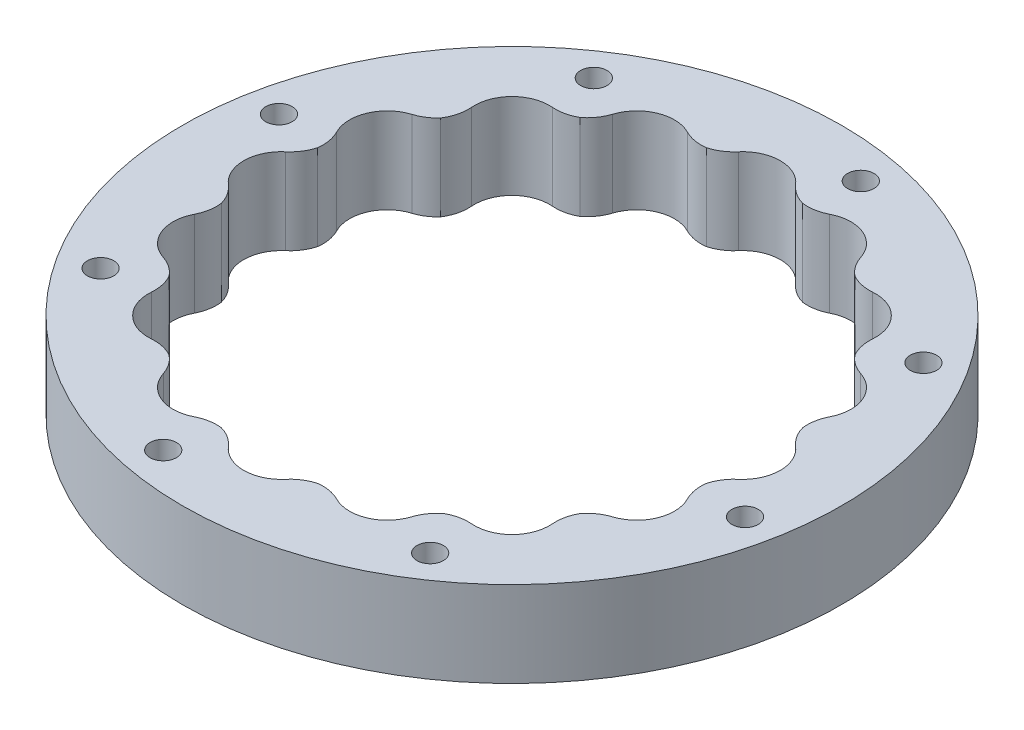
from build123d import *

# Parameters (mm, degrees)
SKETCH1_R           = 50
BOSS_EXTRUDE1_DEPTH = 13
FILLET1_R           = 6
FILLET2_R           = 6
SKETCH2_R           = 2
CUT_EXTRUDE1_DEPTH  = 13
CIRPATTERN1_COUNT   = 8


with BuildPart() as part:
    # Sketch1 → Boss-Extrude1 (new body)
    with BuildSketch(Plane(origin=(0, 0, 0), x_dir=(1, 0, 0), z_dir=(0, 1, 0))):
        with Locations(Location((0, 0, 0), (0, 0, 90))):
            Circle(SKETCH1_R)
        with BuildLine():
            ThreePointArc((36.323181231, 9.32075669), (36.779448015, 7.315887076), (37.125142857, 5.289023335))
            ThreePointArc((37.125142857, 5.289023335), (39.722463038, 3.191918366), (40.7, 0))
            ThreePointArc((40.7, 0), (39.722463038, -3.191918366), (37.125142857, -5.289023335))
            ThreePointArc((37.125142857, -5.289023335), (36.779448015, -7.315887076), (36.323181231, -9.32075669))
            ThreePointArc((36.323181231, -9.32075669), (37.590218254, -11.184640418), (38.035783638, -13.393920133))
            ThreePointArc((38.035783638, -13.393920133), (36.344793491, -17.445813517), (32.275138024, -19.093597502))
            ThreePointArc((32.275138024, -19.093597502), (31.180110461, -20.833883738), (29.991344533, -22.511536001))
            ThreePointArc((29.991344533, -22.511536001), (30.333218561, -23.606997658), (30.448737342, -24.748737342))
            ThreePointArc((30.448737342, -24.748737342), (27.890230009, -29.504893754), (22.511536001, -29.991344533))
            ThreePointArc((22.511536001, -29.991344533), (20.833883738, -31.180110461), (19.093597502, -32.275138024))
            ThreePointArc((19.093597502, -32.275138024), (19.093839474, -32.305460402), (19.093920133, -32.335783638))
            ThreePointArc((19.093920133, -32.335783638), (15.547169813, -37.613426655), (9.32075669, -36.323181231))
            ThreePointArc((9.32075669, -36.323181231), (7.315887076, -36.779448015), (5.289023335, -37.125142857))
            ThreePointArc((5.289023335, -37.125142857), (0, -40.7), (-5.289023335, -37.125142857))
            ThreePointArc((-5.289023335, -37.125142857), (-7.315887076, -36.779448015), (-9.32075669, -36.323181231))
            ThreePointArc((-9.32075669, -36.323181231), (-15.575215697, -37.601896973), (-19.093597502, -32.275138024))
            ThreePointArc((-19.093597502, -32.275138024), (-20.833883738, -31.180110461), (-22.511536001, -29.991344533))
            ThreePointArc((-22.511536001, -29.991344533), (-28.779245994, -28.779245994), (-29.991344533, -22.511536001))
            ThreePointArc((-29.991344533, -22.511536001), (-31.180110461, -20.833883738), (-32.275138024, -19.093597502))
            ThreePointArc((-32.275138024, -19.093597502), (-37.601896973, -15.575215697), (-36.323181231, -9.32075669))
            ThreePointArc((-36.323181231, -9.32075669), (-36.779448015, -7.315887076), (-37.125142857, -5.289023335))
            ThreePointArc((-37.125142857, -5.289023335), (-40.7, 0), (-37.125142857, 5.289023335))
            ThreePointArc((-37.125142857, 5.289023335), (-36.779448015, 7.315887076), (-36.323181231, 9.32075669))
            ThreePointArc((-36.323181231, 9.32075669), (-37.601896973, 15.575215697), (-32.275138024, 19.093597502))
            ThreePointArc((-32.275138024, 19.093597502), (-31.180110461, 20.833883738), (-29.991344533, 22.511536001))
            ThreePointArc((-29.991344533, 22.511536001), (-28.779245994, 28.779245994), (-22.511536001, 29.991344533))
            ThreePointArc((-22.511536001, 29.991344533), (-20.833883738, 31.180110461), (-19.093597502, 32.275138024))
            ThreePointArc((-19.093597502, 32.275138024), (-15.575215697, 37.601896973), (-9.32075669, 36.323181231))
            ThreePointArc((-9.32075669, 36.323181231), (-7.315887076, 36.779448015), (-5.289023335, 37.125142857))
            ThreePointArc((-5.289023335, 37.125142857), (0, 40.7), (5.289023335, 37.125142857))
            ThreePointArc((5.289023335, 37.125142857), (7.315887076, 36.779448015), (9.32075669, 36.323181231))
            ThreePointArc((9.32075669, 36.323181231), (15.547169813, 37.613426655), (19.093920133, 32.335783638))
            ThreePointArc((19.093920133, 32.335783638), (19.093839474, 32.305460402), (19.093597502, 32.275138024))
            ThreePointArc((19.093597502, 32.275138024), (20.833883738, 31.180110461), (22.511536001, 29.991344533))
            ThreePointArc((22.511536001, 29.991344533), (27.890230009, 29.504893754), (30.448737342, 24.748737342))
            ThreePointArc((30.448737342, 24.748737342), (30.333218561, 23.606997658), (29.991344533, 22.511536001))
            ThreePointArc((29.991344533, 22.511536001), (31.180110461, 20.833883738), (32.275138024, 19.093597502))
            ThreePointArc((32.275138024, 19.093597502), (36.344793491, 17.445813517), (38.035783638, 13.393920133))
            ThreePointArc((38.035783638, 13.393920133), (37.590218254, 11.184640418), (36.323181231, 9.32075669))
        make_face(mode=Mode.SUBTRACT)
    extrude(amount=BOSS_EXTRUDE1_DEPTH)

    # Fillet1
    # the kernel refuses this fillet: 6 mm, written as the material it takes off along each edge
    with BuildSketch(Plane(origin=(-19.093597502, -6.083636121, -32.275138024), x_dir=(0.14995847999359607, 0, -0.9886922950433115), z_dir=(0, 1, 0)), Plane(origin=(-29.991344533, -6.083636121, -22.511536001), x_dir=(-0.2398125906274579, 0, -0.9708192011783384), z_dir=(0, 1, 0)), Plane(origin=(-36.323181231, -6.083636121, -9.32075669), x_dir=(-0.5930743682320851, 0, -0.8051476844319388), z_dir=(0, 1, 0)), Plane(origin=(-37.125142857, -6.083636121, 5.289023335), x_dir=(-0.8560459495059065, 0, -0.5168997314127094), z_dir=(0, 1, 0)), Plane(origin=(-32.275138024, -6.083636121, 19.093597502), x_dir=(-0.988692295043333, 0, -0.14995847999345324), z_dir=(0, 1, 0)), Plane(origin=(-22.511536001, -6.083636121, 29.991344533), x_dir=(-0.9708192011784058, 0, 0.23981259062718507), z_dir=(0, 1, 0)), Plane(origin=(-9.32075669, -6.083636121, 36.323181231), x_dir=(-0.8051476844318383, 0, 0.5930743682322216), z_dir=(0, 1, 0)), Plane(origin=(5.289023335, -6.083636121, 37.125142857), x_dir=(-0.5168997314124754, 0, 0.8560459495060478), z_dir=(0, 1, 0)), Plane(origin=(29.991344533, -6.083636121, 22.511536001), x_dir=(0.2398125906274932, 0, 0.9708192011783298), z_dir=(0, 1, 0)), Plane(origin=(36.323181231, -6.083636121, 9.32075669), x_dir=(0.5930743682321865, 0, 0.8051476844318642), z_dir=(0, 1, 0)), Plane(origin=(37.125142857, -6.083636121, -5.289023335), x_dir=(0.8560459495059013, 0, 0.5168997314127179), z_dir=(0, 1, 0)), Plane(origin=(32.275138024, -6.083636121, -19.093597502), x_dir=(0.9886922950433297, 0, 0.14995847999347464), z_dir=(0, 1, 0)), Plane(origin=(9.32075669, -6.083636121, -36.323181231), x_dir=(0.8051476844318497, 0, -0.5930743682322063), z_dir=(0, 1, 0)), Plane(origin=(-5.289023335, -6.083636121, -37.125142857), x_dir=(0.5168997314124864, 0, -0.8560459495060411), z_dir=(0, 1, 0))) as fillet1_piece_1:
        with BuildLine():
            CenterArc((2.792165198, 5.922245026), FILLET1_R, 222.951284649, 37.814580314)
            ThreePointArc((-1.599434612, 1.833987316), (-0.784836973, 0.929970912), (0, 0))
            ThreePointArc((0, 0), (0.914674806, 0.073867225), (1.829349612, 0))
        make_face()
    extrude(amount=25.167272242, mode=Mode.SUBTRACT)
    with BuildSketch(Plane(origin=(-22.511536001, -6.083636121, -29.991344533), x_dir=(0.8188257163349287, 0, -0.5740421990312129), z_dir=(0, 1, 0)), Plane(origin=(-37.125142857, -6.083636121, -5.289023335), x_dir=(0.17308808500835637, 0, -0.9849063482525331), z_dir=(0, 1, 0)), Plane(origin=(-36.323181231, -6.083636121, 9.32075669), x_dir=(-0.21699480284666314, 0, -0.9761727590634447), z_dir=(0, 1, 0)), Plane(origin=(-29.991344533, -6.083636121, 22.511536001), x_dir=(-0.5740421990310322, 0, -0.8188257163350555), z_dir=(0, 1, 0)), Plane(origin=(-19.093597502, -6.083636121, 32.275138024), x_dir=(-0.8436968741184279, 0, -0.5368198809682758), z_dir=(0, 1, 0)), Plane(origin=(-5.289023335, -6.083636121, 37.125142857), x_dir=(-0.9849063482524983, 0, -0.17308808500855408), z_dir=(0, 1, 0)), Plane(origin=(22.511536001, -6.083636121, 29.991344533), x_dir=(-0.8188257163349197, 0, 0.574042199031226), z_dir=(0, 1, 0)), Plane(origin=(32.275138024, -6.083636121, 19.093597502), x_dir=(-0.5368198809683398, 0, 0.8436968741183872), z_dir=(0, 1, 0)), Plane(origin=(37.125142857, -6.083636121, 5.289023335), x_dir=(-0.17308808500835057, 0, 0.984906348252534), z_dir=(0, 1, 0)), Plane(origin=(36.323181231, -6.083636121, -9.32075669), x_dir=(0.21699480284658396, 0, 0.9761727590634621), z_dir=(0, 1, 0)), Plane(origin=(29.991344533, -6.083636121, -22.511536001), x_dir=(0.5740421990310425, 0, 0.8188257163350484), z_dir=(0, 1, 0)), Plane(origin=(19.093597502, -6.083636121, -32.275138024), x_dir=(0.8436968741184294, 0, 0.5368198809682734), z_dir=(0, 1, 0)), Plane(origin=(5.289023335, -6.083636121, -37.125142857), x_dir=(0.9849063482524999, 0, 0.17308808500854556), z_dir=(0, 1, 0)), Plane(origin=(-9.32075669, -6.083636121, -36.323181231), x_dir=(0.976172759063475, 0, -0.2169948028465263), z_dir=(0, 1, 0))) as fillet1_piece_2:
        with BuildLine():
            CenterArc((2.628130804, 5.996840928), FILLET1_R, 230.326071091, 37.814580314)
            ThreePointArc((-1.202375121, 1.378700139), (-0.54551709, 0.73790072), (0, 0))
            ThreePointArc((0, 0), (1.216727224, 0.0197442), (2.433454448, 0))
        make_face()
    extrude(amount=25.167272242, mode=Mode.SUBTRACT)
    with BuildSketch(Plane(origin=(9.32075669, -6.083636122, 36.323181231), x_dir=(-0.9761727590638747, 0, 0.2169948028447281), z_dir=(0, 1, 0))) as fillet1_piece_3:
        with BuildLine():
            CenterArc((2.628130805, 5.996840928), FILLET1_R, 230.326071091, 37.814580314)
            ThreePointArc((-1.202375121, 1.378700139), (-0.54551709, 0.73790072), (0, 0))
            ThreePointArc((0, 0), (1.216727224, 0.0197442), (2.433454449, 0))
        make_face()
    extrude(amount=25.167272243, mode=Mode.SUBTRACT)
    with BuildSketch(Plane(origin=(19.093597502, -6.083636121, 32.275138024), x_dir=(-0.14995847999251055, 0, 0.988692295043476), z_dir=(0, 1, 0))) as fillet1_piece_4:
        with BuildLine():
            CenterArc((2.792165198, 5.922245026), FILLET1_R, 222.951284649, 37.814580314)
            ThreePointArc((-1.599434612, 1.833987316), (-0.784836973, 0.929970912), (0, 0))
            ThreePointArc((0, 0), (0.914674806, 0.073867225), (1.829349613, 0))
        make_face()
    extrude(amount=25.167272242, mode=Mode.SUBTRACT)
    with BuildSketch(Plane(origin=(22.511536001, -6.083636121, -29.991344533), x_dir=(-0.81882571633492, 0, -0.5740421990312257), z_dir=(0, 1, 0))) as fillet1_piece_5:
        with BuildLine():
            CenterArc((2.628130804, -5.996840928), FILLET1_R, 91.859348595, 37.814580314)
            ThreePointArc((-1.202375121, -1.378700139), (-0.54551709, -0.73790072), (0, 0))
            ThreePointArc((0, 0), (1.216727224, -0.0197442), (2.433454448, 0))
        make_face()
    extrude(amount=25.167272242, mode=Mode.SUBTRACT)

    # Fillet2
    # the kernel refuses this fillet: 6 mm, written as the material it takes off along each edge
    with BuildSketch(Plane(origin=(-32.275138024, -4.443316345, -19.093597502), x_dir=(0.5282998062723766, 0, -0.8490578983158743), z_dir=(0, 1, 0))) as fillet2_piece_1:
        with BuildLine():
            CenterArc((2.770578985, 5.899824462), FILLET2_R, 229.219707945, 30.295762434)
            Line((-1.148382112, 1.35650586), (-1.226761334, 1.265639488))
            ThreePointArc((-1.226761334, 1.265639488), (-0.612581404, 0.645752673), (-0.102555687, -0.062308354))
            Line((-0.102555687, -0.062308354), (0.002686014, -0.119969935))
            ThreePointArc((0.002686014, -0.119969935), (0.839379399, -0.110604719), (1.656922395, -0.117996489))
            Line((1.656922395, -0.117996489), (1.678758799, 0))
        make_face()
    extrude(amount=21.88663269, mode=Mode.SUBTRACT)

    # Sketch2 → Cut-Extrude1 (cut)
    with BuildSketch(Plane(origin=(0, 13, 0), x_dir=(1, 0, 0), z_dir=(0, 1, 0))):
        with Locations(Location((37.416132554, 25.000660486, 0), (0, 0, 270))):
            Circle(SKETCH2_R)
    cut_extrude1 = extrude(amount=-CUT_EXTRUDE1_DEPTH, mode=Mode.SUBTRACT)

    # CirPattern1: Cut-Extrude1 ×8 about axis
    cirpattern1_axis = Axis((0, 0, 0), (0, 1, 0))
    for i in range(1, CIRPATTERN1_COUNT):
        add(cut_extrude1.rotate(cirpattern1_axis, i * 360 / CIRPATTERN1_COUNT), mode=Mode.SUBTRACT)


solid = part.part
